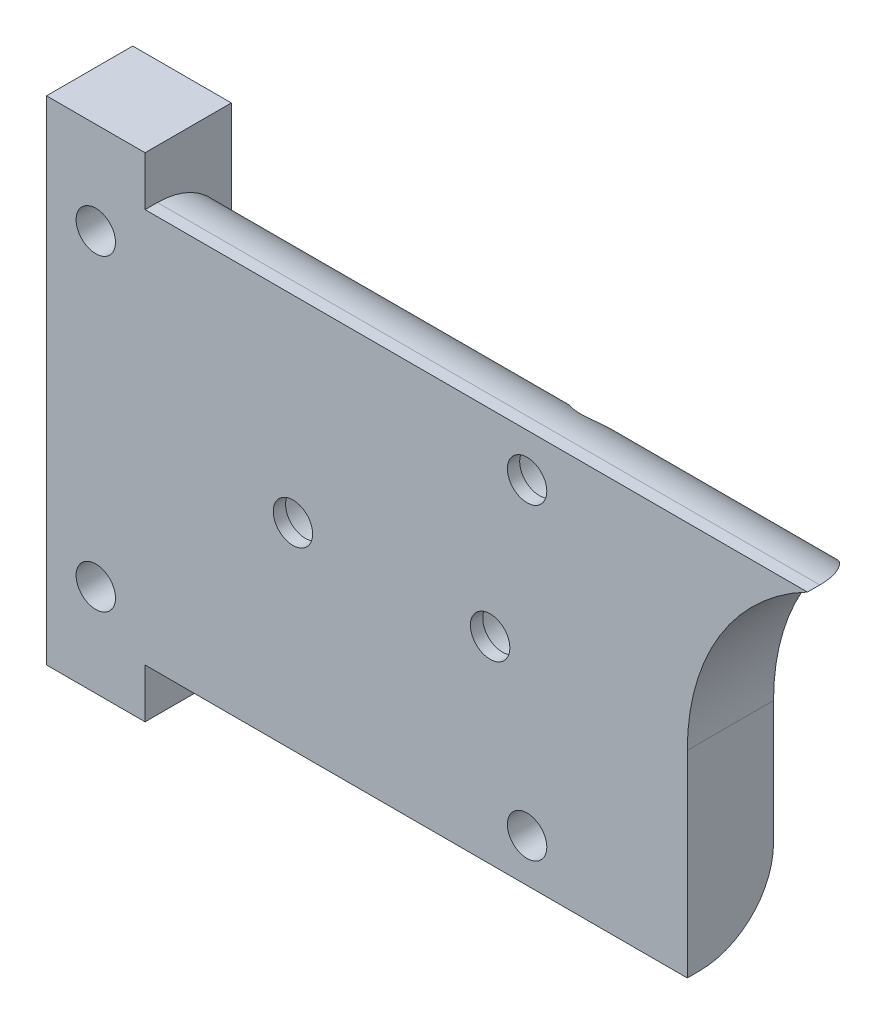
from build123d import *

# Parameters (mm, degrees)
SKETCH1_W           = 4
SKETCH1_H           = 2
BOSS_EXTRUDE1_DEPTH = 3.5
SKETCH2_R           = 0.8
SCREW_HOLES_DEPTH   = 43.383720665
SKETCH3_R           = 1.25
SCREW_HEADS_DEPTH   = 3
FILLET1_R           = 3


with BuildPart() as part:
    # Sketch1 → Boss-Extrude1 (new body)
    with BuildSketch(Plane.XY):
        with BuildLine():
            Line((10.161255894, 0), (36.161255894, 0))
            ThreePointArc((36.161255894, 0), (37.476597455, 4.684658438), (41.038150268, 8))
            Line((41.038150268, 8), (14.161255894, 8))
            Line((14.161255894, 8), (10.161255894, 8))
            Line((10.161255894, 8), (10.161255894, 0))
        make_face()
        Polygon((36.161255894, -8), (36.161255894, 0), (10.161255894, 0), (10.161255894, -8), (14.161255894, -8), align=None)
        with Locations((12.161255894, 9)):
            Rectangle(SKETCH1_W, SKETCH1_H)
        with Locations((12.161255894, -9)):
            Rectangle(SKETCH1_W, SKETCH1_H)
    extrude(amount=BOSS_EXTRUDE1_DEPTH)

    # Sketch2 → Screw Holes (cut, through all)
    with BuildSketch(Plane.XY):
        with Locations((20.161255894, 0)):
            Circle(SKETCH2_R)
        with Locations((12.161255894, -6.25)):
            Circle(SKETCH2_R)
        with Locations((29.661255894, 6.25)):
            Circle(SKETCH2_R)
        with Locations((29.661255894, -6.25)):
            Circle(SKETCH2_R)
        with Locations((12.161255894, 6.25)):
            Circle(SKETCH2_R)
        with Locations((28.161255894, 0)):
            Circle(SKETCH2_R)
    extrude(amount=SCREW_HOLES_DEPTH, mode=Mode.SUBTRACT)

    # Sketch3 → Screw Heads (cut)
    with BuildSketch(Plane.XY):
        with Locations((20.161255894, 0)):
            Circle(SKETCH3_R)
        with Locations((29.661255894, 6.25)):
            Circle(SKETCH3_R)
        with Locations((28.161255894, 0)):
            Circle(SKETCH3_R)
    extrude(amount=SCREW_HEADS_DEPTH, mode=Mode.SUBTRACT)

    # Fillet1
    # the kernel refuses this fillet: 3 mm, written as the material it takes off along each edge
    with BuildSketch(Plane(origin=(48.538150268, 8, 0), x_dir=(0, 0, 1), z_dir=(-1, 0, 0))) as fillet1_piece_1:
        with BuildLine():
            CenterArc((FILLET1_R, -FILLET1_R), FILLET1_R, 90, 90)
            Line((0, -FILLET1_R), (0, 0))
            Line((0, 0), (FILLET1_R, 0))
        make_face()
    extrude(amount=34.376894374, mode=Mode.SUBTRACT)
    with BuildSketch(Plane(origin=(14.161255894, -8, 0), x_dir=(0, 0, 1), z_dir=(1, 0, 0))) as fillet1_piece_2:
        with BuildLine():
            CenterArc((FILLET1_R, -FILLET1_R), FILLET1_R, 90, 90)
            Line((0, -FILLET1_R), (0, 0))
            Line((0, 0), (FILLET1_R, 0))
        make_face()
    extrude(amount=29.5, mode=Mode.SUBTRACT)


solid = part.part
